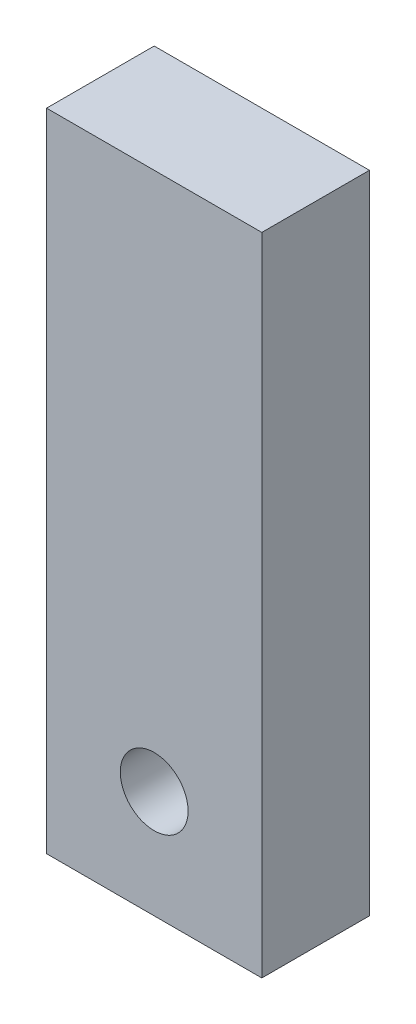
from build123d import *

# Parameters (mm, degrees)
SKETCH1_W           = 25.4
SKETCH1_H           = 76.2
BOSS_EXTRUDE1_DEPTH = 12.7
SKETCH2_R           = 4
CUT_EXTRUDE1_DEPTH  = 43.121134838


with BuildPart() as part:
    # Sketch1 → Boss-Extrude1 (new body)
    with BuildSketch(Plane.XY):
        Rectangle(SKETCH1_W, SKETCH1_H)
    extrude(amount=BOSS_EXTRUDE1_DEPTH)

    # Sketch2 → Cut-Extrude1 (cut, through all)
    with BuildSketch(Plane.XY.offset(12.7)):
        with Locations((0, -25.4)):
            Circle(SKETCH2_R)
    extrude(amount=-CUT_EXTRUDE1_DEPTH, mode=Mode.SUBTRACT)


solid = part.part
